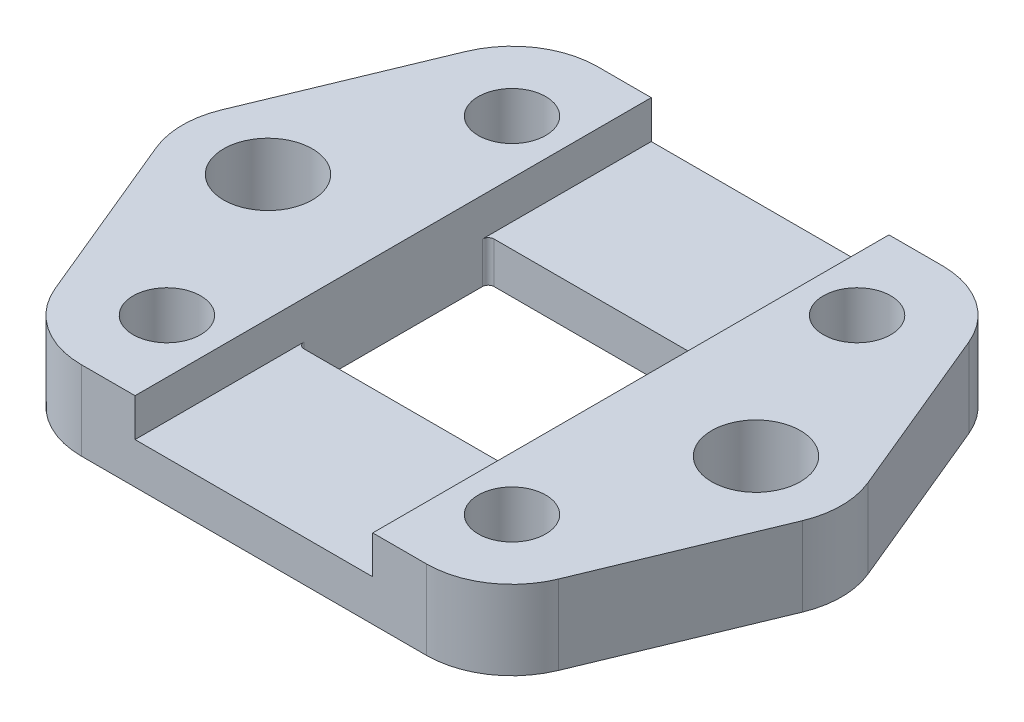
from build123d import *

# Parameters (mm, degrees)
BOSS_EXTRUDE1_DEPTH    = 1.651
SKETCH2_W              = 9.525
SKETCH2_H              = 7.62254
CUT_EXTRUDE1_DEPTH     = 18.079855009
BOSS_EXTRUDE2_DEPTH    = 1.524
BOSS_EXTRUDE3_DEPTH    = 1.524
DRAFT1_DEPTH           = 3.175
DRAFT1_2_DEPTH         = 1.651
M2_5_CLEARANCE_HOLE1_D = 2.7051
M3_CLEARANCE_HOLE1_D   = 3.556
FILLET1_R              = 0.23622
FILLET2_R              = 3.429


# Read off the part's stored shape, not the designer's step: Draft1
with BuildPart() as part:
    # Sketch1 → Boss-Extrude1 (new body)
    with BuildSketch(Plane(origin=(0, 1.651, 0), x_dir=(1, 0, 0), z_dir=(0, 1, 0))):
        Polygon((13.490522855, 0), (9.205835634, 10.34415), (-9.205835634, 10.34415), (-13.490522855, 0), (-9.205835634, -10.34415), (13.019017606, -1.138314366), align=None)
    extrude(amount=-BOSS_EXTRUDE1_DEPTH)

    # Sketch2 → Cut-Extrude1 (cut, through all)
    with BuildSketch(Plane.XZ):
        Rectangle(SKETCH2_W, SKETCH2_H)
    extrude(amount=-CUT_EXTRUDE1_DEPTH, mode=Mode.SUBTRACT)

    # Sketch3 → Boss-Extrude2 (add)
    with BuildSketch(Plane(origin=(0, 1.651, 0), x_dir=(-1, 0, 0), z_dir=(0, 1, 0))):
        Polygon((-9.205835634, -10.34415), (-13.490522855, 0), (-13.019017606, 1.138314366), (-4.7625, 4.558275937), (-4.7625, -10.34415), align=None)
    extrude(amount=BOSS_EXTRUDE2_DEPTH)

    # Sketch4 → Boss-Extrude3 (add)
    with BuildSketch(Plane(origin=(0, 1.651, 0), x_dir=(-1, 0, 0), z_dir=(0, 1, 0))):
        Polygon((9.205835634, 10.34415), (13.490522855, 0), (9.205835634, -10.34415), (4.7625, -10.34415), (4.7625, 8.503660118), align=None)
    extrude(amount=BOSS_EXTRUDE3_DEPTH)

    # Draft1 outline → Draft1 (add)
    with BuildSketch(Plane(origin=(0, 0, 0), x_dir=(1, 0, 0), z_dir=(0, 1, 0))):
        Polygon((4.7625, -10.34415), (9.205835634, -10.34415), (13.019017606, -1.138314366), (4.7625, -4.558275937), align=None)
        Polygon((-9.205835634, -10.34415), (-4.7625, -10.34415), (-4.7625, -8.503660118), align=None)
    extrude(amount=DRAFT1_DEPTH)

    # Draft1 2 outline → Draft1 2 (add)
    with BuildSketch(Plane(origin=(0, 0, 0), x_dir=(1, 0, 0), z_dir=(0, 1, 0))):
        Polygon((-4.7625, -10.34415), (4.7625, -10.34415), (4.7625, -4.558275937), (-4.7625, -8.503660118), align=None)
    extrude(amount=DRAFT1_2_DEPTH)

    # M2.5 Clearance Hole1 (through all)
    with Locations(Plane(origin=(0, 3.175, 0), x_dir=(1, 0, 0), z_dir=(0, 1, 0))):
        with Locations((6.914797213, 6.914797213), (-6.914797213, 6.914797213), (-6.914797213, -6.914797213), (6.914797213, -6.914797213)):
            Hole(M2_5_CLEARANCE_HOLE1_D / 2)

    # M3 Clearance Hole1 (through all)
    with Locations(Plane(origin=(0, 3.175, 0), x_dir=(1, 0, 0), z_dir=(0, 1, 0))):
        with Locations((9.779, 0), (-9.779, 0)):
            Hole(M3_CLEARANCE_HOLE1_D / 2)

    # Fillet1
    fillet1_edges = [part.edges().sort_by_distance(p)[0] for p in [
        (4.7625, 0.8255, 3.81127),
        (4.7625, 0.8255, -3.81127),
        (-4.7625, 0.8255, -3.81127),
        (-4.7625, 0.8255, 3.81127),
    ]]
    fillet(fillet1_edges, radius=FILLET1_R)

    # Fillet2
    fillet2_edges = [part.edges().sort_by_distance(p)[0] for p in [
        (9.205835634, 1.5875, 10.34415),
        (-9.205835634, 1.5875, 10.34415),
        (-13.490522855, 1.5875, 0),
        (-9.205835634, 1.5875, -10.34415),
        (9.205835634, 1.5875, -10.34415),
        (13.490522855, 1.5875, 0),
    ]]
    fillet(fillet2_edges, radius=FILLET2_R)


solid = part.part
